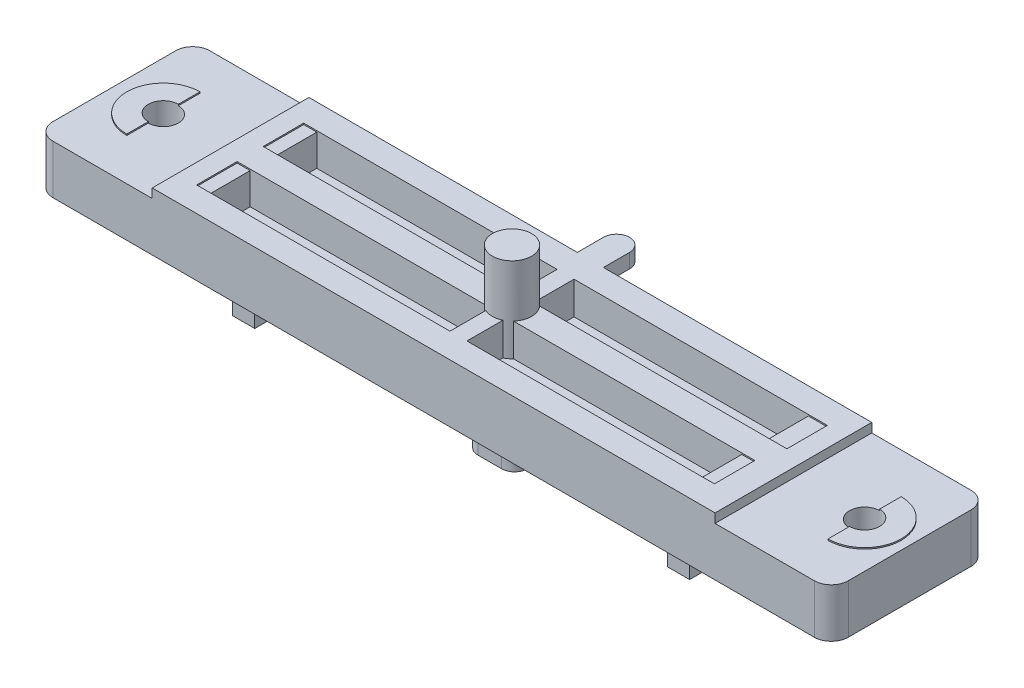
from build123d import *
from build123d.topology import SkipClean

# Parameters (mm, degrees)
CROQUIS1_W              = 60.9
CROQUIS1_H              = 12
SALIENTE_EXTRUIR1_DEPTH = 14
CROQUIS2_OUTSIDE_W      = 75.626
CROQUIS2_OUTSIDE_H      = 26.726
CROQUIS2_OUTSIDE_R      = 1.5
CORTAR_EXTRUIR1_DEPTH   = 4
SALIENTE_EXTRUIR3_DEPTH = 1.1
CROQUIS4_OUTSIDE_W      = 75.752
CROQUIS4_OUTSIDE_H      = 29.852
CORTAR_EXTRUIR2_DEPTH   = 0.7
CORTAR_EXTRUIR3_DEPTH   = 2.5
CROQUIS6_W              = 1.45
CROQUIS6_H              = 3.1
CROQUIS6_W_2            = 1
CORTAR_EXTRUIR4_DEPTH   = 0.1
REDONDEO1_R             = 1
REDONDEO2_R             = 1
SALIENTE_EXTRUIR4_DEPTH = 0.1
CORTAR_EXTRUIR5_REACH   = 64.764
CROQUIS8_R              = 1.15
CROQUIS9_OUTSIDE_W      = 75.752
CROQUIS9_OUTSIDE_H      = 29.852
CORTAR_EXTRUIR7_DEPTH   = 5.55
SALIENTE_EXTRUIR6_DEPTH = 3.5
CROQUIS12_W             = 31.6
CROQUIS12_H             = 1.3
CORTAR_EXTRUIR8_DEPTH   = 2.3
CROQUIS14_W             = 1.3
CROQUIS14_H             = 1
CORTAR_EXTRUIR9_DEPTH   = 2.3
REDONDEO3_R             = 1
CROQUIS15_W             = 7.62
CROQUIS15_H             = 9.4
CROQUIS15_W_2           = 7.6
CORTAR_EXTRUIR10_DEPTH  = 1.9
REDONDEO4_R             = 1.3
REDONDEO5_R             = 1.3
REDONDEO6_R             = 1.3
REDONDEO7_R             = 1


# Some blends are built 0.0001 mm under size
with BuildPart() as part:
    # Croquis1 → Saliente-Extruir1 (new body)
    with BuildSketch(Plane(origin=(0, 0, 0), x_dir=(1, 0, 0), z_dir=(0, 1, 0))):
        with Locations((30.45, -6)):
            Rectangle(CROQUIS1_W, CROQUIS1_H)
    extrude(amount=SALIENTE_EXTRUIR1_DEPTH)

    # Croquis2 outside → Cortar-Extruir1 (cut)
    with BuildSketch(Plane(origin=(0, 14, 0), x_dir=(1, 0, 0), z_dir=(0, 1, 0))):
        with Locations((30.45, -6)):
            Rectangle(CROQUIS2_OUTSIDE_W, CROQUIS2_OUTSIDE_H)
        with Locations(Location((30.45, -6, 0), (0, 0, 270))):
            Circle(CROQUIS2_OUTSIDE_R, mode=Mode.SUBTRACT)
    extrude(amount=-CORTAR_EXTRUIR1_DEPTH, mode=Mode.SUBTRACT)

    # Croquis3 → Saliente-Extruir3 (add)
    with BuildSketch(Plane(origin=(0, 10, 0), x_dir=(1, 0, 0), z_dir=(0, 1, 0))):
        Polygon((30.45, 0), (29.45, 0), (29.45, 3), (31.45, 3), (31.45, 0), align=None)
    extrude(amount=-SALIENTE_EXTRUIR3_DEPTH)

    # Croquis4 outside → Cortar-Extruir2 (cut)
    with BuildSketch(Plane(origin=(0, 10, 0), x_dir=(1, 0, 0), z_dir=(0, 1, 0))):
        with Locations((30.45, -4.5)):
            Rectangle(CROQUIS4_OUTSIDE_W, CROQUIS4_OUTSIDE_H)
        Polygon((8.9, -6), (8.9, 0), (29.45, 0), (29.45, 3), (31.45, 3), (31.45, 0), (52, 0), (52, -12), (8.9, -12), align=None, mode=Mode.SUBTRACT)
    extrude(amount=-CORTAR_EXTRUIR2_DEPTH, mode=Mode.SUBTRACT)

    # Croquis5 → Cortar-Extruir3 (cut)
    with SkipClean():  # the faces are left unmerged after this step: merging them gives an invalid solid
        with BuildSketch(Plane(origin=(0, 10, 0), x_dir=(1, 0, 0), z_dir=(0, 1, 0))):
            with BuildLine():
                ThreePointArc((29.331966011, -5), (29.548647819, -4.801015327), (29.8, -4.648149417))
                Line((29.8, -4.648149417), (29.8, -1.9))
                Line((29.8, -1.9), (11.4, -1.9))
                Line((11.4, -1.9), (11.4, -5))
                Line((11.4, -5), (29.331966011, -5))
            make_face()
            with BuildLine():
                ThreePointArc((29.8, -7.351850583), (29.548647819, -7.198984673), (29.331966011, -7))
                Line((29.331966011, -7), (11.4, -7))
                Line((11.4, -7), (11.4, -10.1))
                Line((11.4, -10.1), (29.8, -10.1))
                Line((29.8, -10.1), (29.8, -7.351850583))
            make_face()
            with BuildLine():
                Line((49.05, -7), (31.568033989, -7))
                ThreePointArc((31.568033989, -7), (31.351352181, -7.198984673), (31.1, -7.351850583))
                Line((31.1, -7.351850583), (31.1, -10.1))
                Line((31.1, -10.1), (49.05, -10.1))
                Line((49.05, -10.1), (49.05, -7))
            make_face()
            with BuildLine():
                Line((49.05, -5), (49.05, -1.9))
                Line((49.05, -1.9), (31.1, -1.9))
                Line((31.1, -1.9), (31.1, -4.648149417))
                ThreePointArc((31.1, -4.648149417), (31.351352181, -4.801015327), (31.568033989, -5))
                Line((31.568033989, -5), (49.05, -5))
            make_face()
        extrude(amount=-CORTAR_EXTRUIR3_DEPTH, mode=Mode.SUBTRACT)

    # Croquis6 → Cortar-Extruir4 (cut)
    with SkipClean():  # the faces are left unmerged after this step: merging them gives an invalid solid
        with BuildSketch(Plane(origin=(0, 10, 0), x_dir=(1, 0, 0), z_dir=(0, 1, 0))):
            with Locations((49.775, -3.45)):
                Rectangle(CROQUIS6_W, CROQUIS6_H)
            with Locations((49.55, -8.55)):
                Rectangle(CROQUIS6_W_2, CROQUIS6_H)
            with Locations((10.9, -3.45)):
                Rectangle(CROQUIS6_W_2, CROQUIS6_H)
            with Locations((10.9, -8.55)):
                Rectangle(CROQUIS6_W_2, CROQUIS6_H)
        extrude(amount=-CORTAR_EXTRUIR4_DEPTH, mode=Mode.SUBTRACT)

    # Redondeo1
    redondeo1_edges = [part.edges().sort_by_distance(p)[0] for p in [
        (31.45, 9.45, -3),
    ]]
    fillet(redondeo1_edges, radius=REDONDEO1_R)

    # Redondeo2
    redondeo2_edges = [part.edges().sort_by_distance(p)[0] for p in [
        (29.45, 9.45, -3),
    ]]
    fillet(redondeo2_edges, radius=REDONDEO2_R - 0.0001)  # a hair under: the kernel refuses the full size

    # Croquis7 → Saliente-Extruir4 (add)
    with BuildSketch(Plane(origin=(0, 9.3, 0), x_dir=(1, 0, 0), z_dir=(0, 1, 0))):
        with BuildLine():
            Line((57.45, -8.8), (57.45, -7.15))
            ThreePointArc((57.45, -7.15), (58.6, -6), (57.45, -4.85))
            Line((57.45, -4.85), (57.45, -3.2))
            ThreePointArc((57.45, -3.2), (60.25, -6), (57.45, -8.8))
        make_face()
        with BuildLine():
            Line((3.75, -4.85), (3.75, -3.2))
            ThreePointArc((3.75, -3.2), (0.95, -6), (3.75, -8.8))
            Line((3.75, -8.8), (3.75, -7.15))
            ThreePointArc((3.75, -7.15), (2.6, -6), (3.75, -4.85))
        make_face()
    extrude(amount=SALIENTE_EXTRUIR4_DEPTH)

    # Croquis8 → Cortar-Extruir5 (cut, up to next)
    with BuildSketch(Plane(origin=(0, 9.3, 0), x_dir=(1, 0, 0), z_dir=(0, 1, 0)), mode=Mode.PRIVATE) as cortar_extruir5_sk1:
        with Locations(Location((57.45, -6, 0), (0, 0, 90))):
            Circle(CROQUIS8_R)
    cortar_extruir5_tool1 = extrude(cortar_extruir5_sk1.sketch, amount=-CORTAR_EXTRUIR5_REACH, mode=Mode.PRIVATE) & part.part
    # Croquis8 → Cortar-Extruir5 (cut, up to next)
    with BuildSketch(Plane(origin=(0, 9.3, 0), x_dir=(1, 0, 0), z_dir=(0, 1, 0)), mode=Mode.PRIVATE) as cortar_extruir5_sk2:
        with Locations(Location((3.75, -6, 0), (0, 0, 90))):
            Circle(CROQUIS8_R)
    cortar_extruir5_tool2 = extrude(cortar_extruir5_sk2.sketch, amount=-CORTAR_EXTRUIR5_REACH, mode=Mode.PRIVATE) & part.part
    add(cortar_extruir5_tool1.solids().sort_by_distance((57.45, 9.3, 6))[0], mode=Mode.SUBTRACT)
    add(cortar_extruir5_tool2.solids().sort_by_distance((3.75, 9.3, 6))[0], mode=Mode.SUBTRACT)

    # Croquis9 outside → Cortar-Extruir7 (cut)
    with BuildSketch(Plane.XZ):
        with Locations((30.45, 4.5)):
            Rectangle(CROQUIS9_OUTSIDE_W, CROQUIS9_OUTSIDE_H)
        Polygon((30, 7.25), (28.1, 7.25), (28.1, 4.75), (31.9, 4.75), (31.9, 7.25), align=None, mode=Mode.SUBTRACT)
    extrude(amount=-CORTAR_EXTRUIR7_DEPTH, mode=Mode.SUBTRACT)

    # Croquis10 → Saliente-Extruir6 (add)
    with BuildSketch(Plane.XZ.offset(-5.55)):
        Polygon((30.65, 4.75), (29.35, 4.75), (29.35, 3.75), (14.2, 3.75), (14.2, 5.34), (15.8, 5.34), (15.8, 5.95), (15.8, 6.56), (14.2, 6.56), (14.2, 9.45), (12.5, 9.45), (12.5, 2.45), (29.35, 2.45), (30, 2.45), (30.65, 2.45), (47.5, 2.45), (47.5, 9.45), (45.8, 9.45), (45.8, 6.56), (44.2, 6.56), (44.2, 5.95), (44.2, 5.34), (45.8, 5.34), (45.8, 3.75), (30.65, 3.75), align=None)
    extrude(amount=SALIENTE_EXTRUIR6_DEPTH)

    # Croquis12 → Cortar-Extruir8 (cut)
    with BuildSketch(Plane.XZ.offset(-2.05)):
        with Locations((30, 3.1)):
            Rectangle(CROQUIS12_W, CROQUIS12_H)
    extrude(amount=-CORTAR_EXTRUIR8_DEPTH, mode=Mode.SUBTRACT)

    # Croquis14 → Cortar-Extruir9 (cut)
    with BuildSketch(Plane.XZ.offset(-2.05)):
        with Locations((30, 4.25)):
            Rectangle(CROQUIS14_W, CROQUIS14_H)
    extrude(amount=-CORTAR_EXTRUIR9_DEPTH, mode=Mode.SUBTRACT)

    # Redondeo3
    # the kernel refuses this fillet: 1 mm, written as the material it adds along each edge
    with BuildSketch(Plane(origin=(29.35, 4.35, 4.75), x_dir=(0, -1, 0), z_dir=(1, 0, 0))) as redondeo3_piece_1:
        with BuildLine():
            CenterArc((REDONDEO3_R, REDONDEO3_R), REDONDEO3_R, 180, 90)
            Line((0, REDONDEO3_R), (0, 0))
            Line((0, 0), (REDONDEO3_R, 0))
        make_face()
    extrude(amount=1.3)

    # Croquis15 → Cortar-Extruir10 (cut)
    with BuildSketch(Plane.XZ.offset(-5.55)):
        with Locations((55.79, 6)):
            Rectangle(CROQUIS15_W, CROQUIS15_H)
        with Locations((5.1, 6)):
            Rectangle(CROQUIS15_W_2, CROQUIS15_H)
    extrude(amount=-CORTAR_EXTRUIR10_DEPTH, mode=Mode.SUBTRACT)

    # Redondeo4
    redondeo4_edges = [part.edges().sort_by_distance(p)[0] for p in [
        (60.9, 7.425, 0),
    ]]
    fillet(redondeo4_edges, radius=REDONDEO4_R)

    # Redondeo5
    redondeo5_edges = [part.edges().sort_by_distance(p)[0] for p in [
        (60.9, 7.425, 12),
        (0, 7.425, 12),
        (0, 7.425, 0),
    ]]
    fillet(redondeo5_edges, radius=REDONDEO5_R)

    # Redondeo6
    redondeo6_edges = [part.edges().sort_by_distance(p)[0] for p in [
        (59.6, 6.5, 10.7),
        (59.6, 6.5, 1.3),
        (1.3, 6.5, 1.3),
        (1.3, 6.5, 10.7),
    ]]
    fillet(redondeo6_edges, radius=REDONDEO6_R)

    # Redondeo7
    redondeo7_edges = [part.edges().sort_by_distance(p)[0] for p in [
        (31.9, 2.775, 4.75),
        (28.1, 2.775, 4.75),
        (28.1, 2.775, 7.25),
        (31.9, 2.775, 7.25),
    ]]
    fillet(redondeo7_edges, radius=REDONDEO7_R)


solid = part.part
